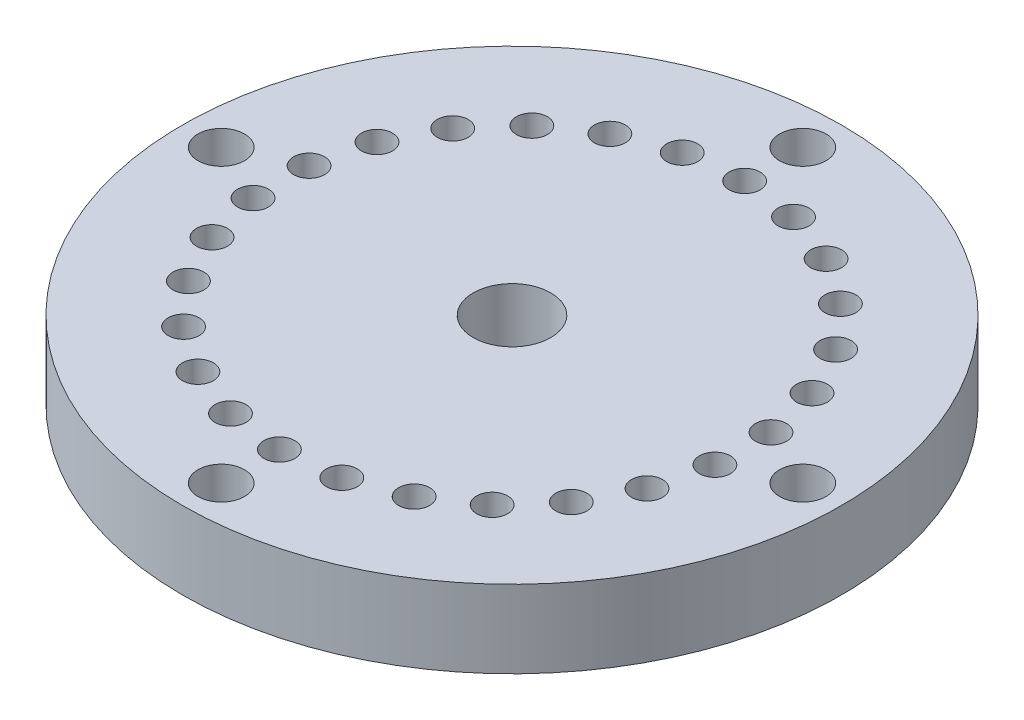
from build123d import *

# Parameters (mm, degrees)
ESQUISSE1_R        = 4.25
ESQUISSE1_R_2      = 0.5
ESQUISSE1_R_3      = 0.2
ESQUISSE1_R_4      = 0.3
BOSS_EXTRU_2_DEPTH = 1


with BuildPart() as part:
    # Esquisse1 → Boss.-Extru.2 (new body)
    with BuildSketch(Plane(origin=(0, 0, 0), x_dir=(1, 0, 0), z_dir=(0, 1, 0))):
        Circle(ESQUISSE1_R)
        Circle(ESQUISSE1_R_2, mode=Mode.SUBTRACT)
        with Locations((0, 3)):
            Circle(ESQUISSE1_R_3, mode=Mode.SUBTRACT)
        with Locations((0, 3.75)):
            Circle(ESQUISSE1_R_4, mode=Mode.SUBTRACT)
        with Locations((0.717946993, 2.912825452)):
            Circle(ESQUISSE1_R_3, mode=Mode.SUBTRACT)
        with Locations((1.394169516, 2.656368077)):
            Circle(ESQUISSE1_R_3, mode=Mode.SUBTRACT)
        with Locations((1.989367975, 2.245532245)):
            Circle(ESQUISSE1_R_3, mode=Mode.SUBTRACT)
        with Locations((2.468951598, 1.70419424)):
            Circle(ESQUISSE1_R_3, mode=Mode.SUBTRACT)
        with Locations((2.805048728, 1.063814661)):
            Circle(ESQUISSE1_R_3, mode=Mode.SUBTRACT)
        with Locations((2.978126622, 0.361610041)):
            Circle(ESQUISSE1_R_3, mode=Mode.SUBTRACT)
        with Locations((2.978126622, -0.361610041)):
            Circle(ESQUISSE1_R_3, mode=Mode.SUBTRACT)
        with Locations((2.805048728, -1.063814661)):
            Circle(ESQUISSE1_R_3, mode=Mode.SUBTRACT)
        with Locations((2.468951598, -1.70419424)):
            Circle(ESQUISSE1_R_3, mode=Mode.SUBTRACT)
        with Locations((1.989367975, -2.245532245)):
            Circle(ESQUISSE1_R_3, mode=Mode.SUBTRACT)
        with Locations((1.394169516, -2.656368077)):
            Circle(ESQUISSE1_R_3, mode=Mode.SUBTRACT)
        with Locations((0.717946993, -2.912825452)):
            Circle(ESQUISSE1_R_3, mode=Mode.SUBTRACT)
        with Locations((0, -3)):
            Circle(ESQUISSE1_R_3, mode=Mode.SUBTRACT)
        with Locations((-0.717946993, -2.912825452)):
            Circle(ESQUISSE1_R_3, mode=Mode.SUBTRACT)
        with Locations((-1.394169516, -2.656368077)):
            Circle(ESQUISSE1_R_3, mode=Mode.SUBTRACT)
        with Locations((-1.989367975, -2.245532245)):
            Circle(ESQUISSE1_R_3, mode=Mode.SUBTRACT)
        with Locations((-2.468951598, -1.70419424)):
            Circle(ESQUISSE1_R_3, mode=Mode.SUBTRACT)
        with Locations((-2.805048728, -1.063814661)):
            Circle(ESQUISSE1_R_3, mode=Mode.SUBTRACT)
        with Locations((-2.978126622, -0.361610041)):
            Circle(ESQUISSE1_R_3, mode=Mode.SUBTRACT)
        with Locations((-2.978126622, 0.361610041)):
            Circle(ESQUISSE1_R_3, mode=Mode.SUBTRACT)
        with Locations((-2.805048728, 1.063814661)):
            Circle(ESQUISSE1_R_3, mode=Mode.SUBTRACT)
        with Locations((-2.468951598, 1.70419424)):
            Circle(ESQUISSE1_R_3, mode=Mode.SUBTRACT)
        with Locations((-1.989367975, 2.245532245)):
            Circle(ESQUISSE1_R_3, mode=Mode.SUBTRACT)
        with Locations((-1.394169516, 2.656368077)):
            Circle(ESQUISSE1_R_3, mode=Mode.SUBTRACT)
        with Locations((-0.717946993, 2.912825452)):
            Circle(ESQUISSE1_R_3, mode=Mode.SUBTRACT)
        with Locations((3.75, 0)):
            Circle(ESQUISSE1_R_4, mode=Mode.SUBTRACT)
        with Locations((0, -3.75)):
            Circle(ESQUISSE1_R_4, mode=Mode.SUBTRACT)
        with Locations((-3.75, 0)):
            Circle(ESQUISSE1_R_4, mode=Mode.SUBTRACT)
    extrude(amount=BOSS_EXTRU_2_DEPTH)


solid = part.part
